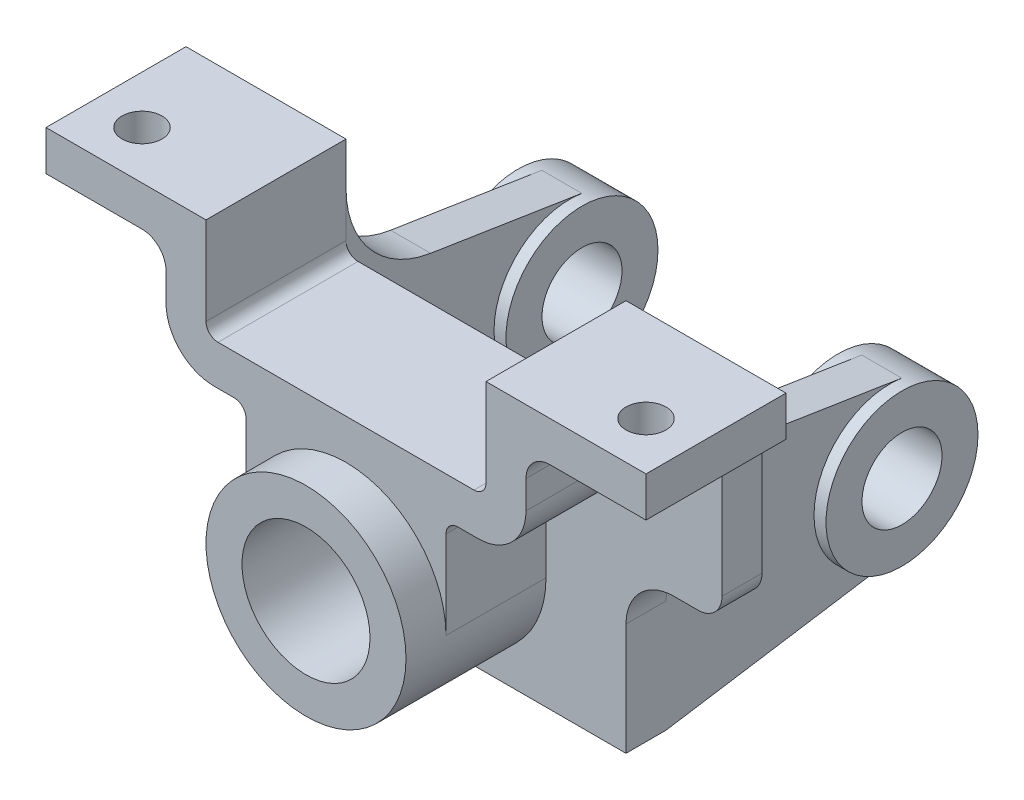
from build123d import *

# Parameters (mm, degrees)
IZIM1_R                     = 25
IZIM1_R_2                   = 16
Y_KSEKLIK_EKSTR_ZYON1_DEPTH = 45
Y_KSEKLIK_EKSTR_ZYON2_DEPTH = 35
Y_KSEKLIK_EKSTR_ZYON4_START = -10
Y_KSEKLIK_EKSTR_ZYON4_DEPTH = 10
RADYUS2_R                   = 6
IZIM6_R                     = 10
Y_KSEKLIK_EKSTR_ZYON6_DEPTH = 10
IZIM7_R                     = 19
IZIM7_R_2                   = 10
Y_KSEKLIK_EKSTR_ZYON7_DEPTH = 8
RADYUS3_R                   = 25
AYNALAMA1_START             = -45
AYNALAMA1_OUTLINE_R         = 10
AYNALAMA1_DEPTH             = 10
AYNALAMA1_START_2           = -48
AYNALAMA1_2_OUTLINE_R       = 19
AYNALAMA1_2_OUTLINE_R_2     = 10
AYNALAMA1_2_DEPTH           = 16
IZIM8_R                     = 5
KES_EKSTR_ZYON1_DEPTH       = 16


# Read off the part's stored shape, not the designer's step: Aynalama1
# Some blends are built 0.0001 mm under size
with BuildPart() as part:
    # Çizim1 → Yükseklik-Ekstrüzyon1 (new body)
    with BuildSketch(Plane.XY):
        Circle(IZIM1_R)
        Circle(IZIM1_R_2, mode=Mode.SUBTRACT)
    extrude(amount=-Y_KSEKLIK_EKSTR_ZYON1_DEPTH)

    # Çizim4 → Yükseklik-Ekstrüzyon2 (add)
    with BuildSketch(Plane.XY.offset(-10)):
        with BuildLine():
            Line((25, 0), (25, 22))
            ThreePointArc((25, 22), (25.878679656, 24.121320344), (28, 25))
            Line((28, 25), (33, 25))
            ThreePointArc((33, 25), (41.485281374, 28.514718626), (45, 37))
            Line((45, 37), (45, 44))
            ThreePointArc((45, 44), (46.757359313, 48.242640687), (51, 50))
            Line((51, 50), (75, 50))
            Line((75, 50), (75, 60))
            Line((75, 60), (35, 60))
            Line((35, 60), (35, 38))
            ThreePointArc((35, 38), (34.121320344, 35.878679656), (32, 35))
            Line((32, 35), (-32, 35))
            ThreePointArc((-32, 35), (-34.121320344, 35.878679656), (-35, 38))
            Line((-35, 38), (-35, 60))
            Line((-35, 60), (-75, 60))
            Line((-75, 60), (-75, 50))
            Line((-75, 50), (-51, 50))
            ThreePointArc((-51, 50), (-46.757359313, 48.242640687), (-45, 44))
            Line((-45, 44), (-45, 37))
            ThreePointArc((-45, 37), (-41.485281374, 28.514718626), (-33, 25))
            Line((-33, 25), (-28, 25))
            ThreePointArc((-28, 25), (-25.878679656, 24.121320344), (-25, 22))
            Line((-25, 22), (-25, 0))
            ThreePointArc((-25, 0), (0, 25), (25, 0))
        make_face()
    extrude(amount=-Y_KSEKLIK_EKSTR_ZYON2_DEPTH)

    # Çizim5 → Yükseklik-Ekstrüzyon4 (add)
    with BuildSketch(Plane(origin=(0, 0, -45), x_dir=(-1, 0, 0), z_dir=(0, 0, -1)).offset(Y_KSEKLIK_EKSTR_ZYON4_START)):
        with BuildLine():
            Line((69, 50), (69, 18))
            ThreePointArc((69, 18), (67.242640687, 13.757359313), (63, 12))
            Line((63, 12), (57, 12))
            ThreePointArc((57, 12), (48.514718626, 8.485281374), (45, 0))
            Line((45, 0), (45, -28))
            Line((45, -28), (-45, -28))
            Line((-45, -28), (-45, 0))
            ThreePointArc((-45, 0), (-48.514718626, 8.485281374), (-57, 12))
            Line((-57, 12), (-63, 12))
            ThreePointArc((-63, 12), (-67.242640687, 13.757359313), (-69, 18))
            Line((-69, 18), (-69, 50))
            Line((-69, 50), (-51, 50))
            ThreePointArc((-51, 50), (-46.757359313, 48.242640687), (-45, 44))
            Line((-45, 44), (-45, 37))
            ThreePointArc((-45, 37), (-41.485281374, 28.514718626), (-33, 25))
            Line((-33, 25), (-28, 25))
            ThreePointArc((-28, 25), (-25.878679656, 24.121320344), (-25, 22))
            Line((-25, 22), (-25, 0))
            ThreePointArc((-25, 0), (0, -25), (25, 0))
            Line((25, 0), (25, 22))
            ThreePointArc((25, 22), (25.878679656, 24.121320344), (28, 25))
            Line((28, 25), (33, 25))
            ThreePointArc((33, 25), (41.485281374, 28.514718626), (45, 37))
            Line((45, 37), (45, 44))
            ThreePointArc((45, 44), (46.757359313, 48.242640687), (51, 50))
            Line((51, 50), (69, 50))
        make_face()
    extrude(amount=Y_KSEKLIK_EKSTR_ZYON4_DEPTH)

    # Radyus2
    radyus2_edges = [part.edges().sort_by_distance(p)[0] for p in [
        (-69, 50, -40),
        (69, 50, -40),
    ]]
    fillet(radyus2_edges, radius=RADYUS2_R - 0.0001)  # a hair under: the kernel refuses the full size

    # Çizim6 → Yükseklik-Ekstrüzyon6 (add)
    with BuildSketch(Plane(origin=(45, 0, 0), x_dir=(0, 0, -1), z_dir=(1, 0, 0))):
        with BuildLine():
            Line((45, -28), (103.939212458, -18.771282059))
            ThreePointArc((103.939212458, -18.771282059), (120, 0), (103.939212458, 18.771282059))
            Line((103.939212458, 18.771282059), (45, 28))
            Line((45, 28), (45, -28))
        make_face()
        with Locations((101, 0)):
            Circle(IZIM6_R, mode=Mode.SUBTRACT)
    extrude(amount=-Y_KSEKLIK_EKSTR_ZYON6_DEPTH)

    # Çizim7 → Yükseklik-Ekstrüzyon7 (add, symmetric)
    with BuildSketch(Plane(origin=(40, 0, 0), x_dir=(0, 0, -1), z_dir=(1, 0, 0))):
        with Locations((101, 0)):
            Circle(IZIM7_R)
        with Locations((101, 0)):
            Circle(IZIM7_R_2, mode=Mode.SUBTRACT)
    extrude(amount=Y_KSEKLIK_EKSTR_ZYON7_DEPTH, both=True)

    # Radyus3
    # the kernel refuses this fillet: 25 mm, written as the material it adds along each edge
    with BuildSketch(Plane(origin=(45, 28, -45), x_dir=(0, 1, 0), z_dir=(-1, 0, 0))) as radyus3_piece_1:
        with BuildLine():
            CenterArc((RADYUS3_R * 0.855604187922, RADYUS3_R), RADYUS3_R, 188.899130451, 81.100869549)
            Line((-RADYUS3_R * 0.132358025694, RADYUS3_R * 0.845304607478), (0, 0))
            Line((0, 0), (RADYUS3_R * 0.855604187922, 0))
        make_face()
    extrude(amount=10)

    # Aynalama1 outline → Aynalama1 (add)
    with BuildSketch(Plane.YZ.offset(AYNALAMA1_START)):
        with BuildLine():
            ThreePointArc((-18.771282059, -103.939212458), (0, -120), (18.771282059, -103.939212458))
            Line((18.771282059, -103.939212458), (24.691049358, -66.132615187))
            ThreePointArc((24.691049358, -66.132615187), (33.137176044, -51.004150186), (49.390104698, -45))
            Line((49.390104698, -45), (-28, -45))
            Line((-28, -45), (-18.771282059, -103.939212458))
        make_face()
        with Locations((0, -101)):
            Circle(AYNALAMA1_OUTLINE_R, mode=Mode.SUBTRACT)
    extrude(amount=AYNALAMA1_DEPTH)

    # Aynalama1 2 outline → Aynalama1 2 (add)
    with BuildSketch(Plane.YZ.offset(AYNALAMA1_START_2)):
        with Locations((0, -101)):
            Circle(AYNALAMA1_2_OUTLINE_R)
        with Locations((0, -101)):
            Circle(AYNALAMA1_2_OUTLINE_R_2, mode=Mode.SUBTRACT)
    extrude(amount=AYNALAMA1_2_DEPTH)

    # Çizim8 → Kes-Ekstrüzyon1 (cut)
    with BuildSketch(Plane.XZ.offset(-50)):
        with Locations((63, -22)):
            Circle(IZIM8_R)
        with Locations(Location((-63, -22, 0), (0, 0, 90))):
            Circle(IZIM8_R)
    extrude(amount=-KES_EKSTR_ZYON1_DEPTH, mode=Mode.SUBTRACT)


solid = part.part
